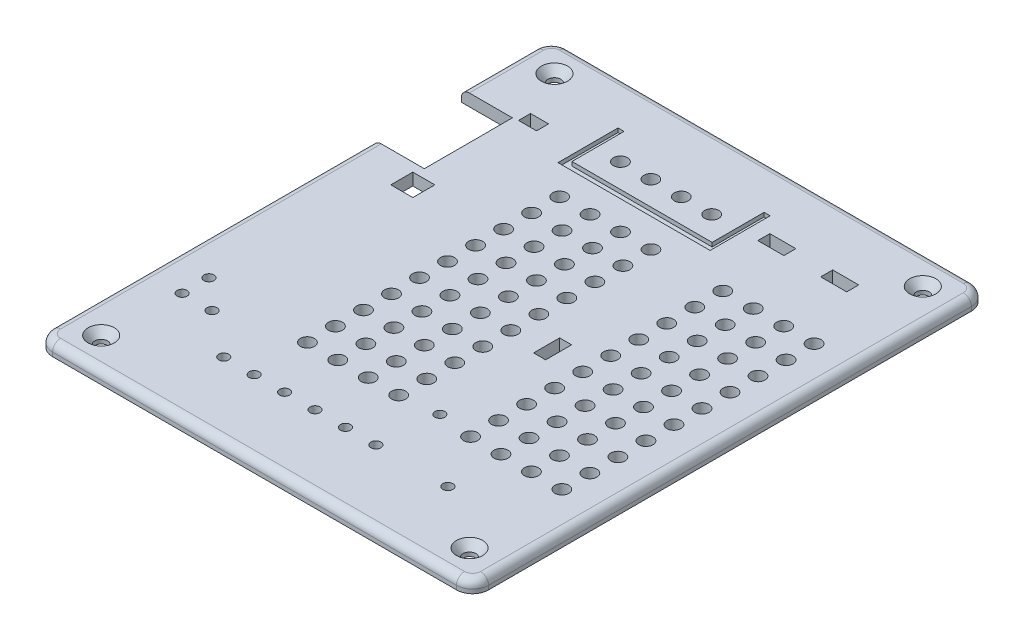
from build123d import *
from OCP.BRepFilletAPI import BRepFilletAPI_MakeChamfer

# Parameters (mm, degrees)
SKICA1_W                 = 108.89
SKICA1_H                 = 128.6
P_IDAT_VYSUNUT_M1_DEPTH  = 3
ZAOBLIT1_R               = 4
ZAOBLIT2_R               = 2
SKICA2_R                 = 1.6
ODEBRAT_VYSUNUT_M1_DEPTH = 3
LINPOLE1_COUNT           = 2
LINPOLE1_PITCH           = 113.2
LINPOLE1_COUNT_DIR2      = 2
LINPOLE1_PITCH_DIR2      = 92
ZKOSEN_1_SIZE            = 2
ZKOSEN_1_SIZE2           = 1.678199262
SKICA3_R                 = 1.75
ODEBRAT_VYSUNUT_M3_DEPTH = 4
LINPOLE3_COUNT           = 10
LINPOLE3_PITCH           = 7
LINPOLE3_COUNT_DIR2      = 4
LINPOLE3_PITCH_DIR2      = 7.6
SKICA3_3_R               = 1.75
ODEBRAT_VYSUNUT_M4_DEPTH = 4
LINPOLE4_COUNT           = 10
LINPOLE4_PITCH           = 7
LINPOLE4_COUNT_DIR2      = 4
LINPOLE4_PITCH_DIR2      = 7.6
SKICA3_4_R               = 1.75
ODEBRAT_VYSUNUT_M5_DEPTH = 10
LINPOLE5_COUNT           = 4
LINPOLE5_PITCH           = 7.6
SKICA4_R                 = 1.25
SKICA4_W                 = 6.5
SKICA4_H                 = 3
SKICA4_W_2               = 3
SKICA4_H_2               = 6.5
ODEBRAT_VYSUNUT_M6_DEPTH = 10
SKICA5_R                 = 1.25
ODEBRAT_VYSUNUT_M7_DEPTH = 10
LINPOLE6_COUNT           = 6
LINPOLE6_PITCH           = 7.6
SKICA6_W                 = 5.5
SKICA6_H                 = 5.5
SKICA6_W_2               = 12.745
SKICA6_H_2               = 22
SKICA6_W_3               = 4.5
SKICA6_H_3               = 3
ODEBRAT_VYSUNUT_M8_DEPTH = 10
ODEBRAT_VYSUNUT_M9_DEPTH = 1


with BuildPart() as part:
    # Skica1 → Přidat vysunutím1 (new body)
    with BuildSketch(Plane(origin=(0, 0, 0), x_dir=(1, 0, 0), z_dir=(0, 1, 0))):
        Rectangle(SKICA1_W, SKICA1_H)
    extrude(amount=P_IDAT_VYSUNUT_M1_DEPTH)

    # Zaoblit1
    zaoblit1_edges = [part.edges().sort_by_distance(p)[0] for p in [
        (54.445, 1.5, -64.3),
        (54.445, 1.5, 64.3),
        (-54.445, 1.5, -64.3),
        (-54.445, 1.5, 64.3),
    ]]
    fillet(zaoblit1_edges, radius=ZAOBLIT1_R)

    # Zaoblit2
    zaoblit2_edges = [part.edges().sort_by_distance(p)[0] for p in [
        (53.273427125, 3, 63.128427125),
        (0, 3, 64.3),
        (-53.273427125, 3, 63.128427125),
        (-54.445, 3, 0),
        (-53.273427125, 3, -63.128427125),
        (0, 3, -64.3),
        (53.273427125, 3, -63.128427125),
        (54.445, 3, 0),
    ]]
    fillet(zaoblit2_edges, radius=ZAOBLIT2_R)

    # Skica2 → Odebrat vysunutím1 (cut)
    with BuildSketch(Plane.XZ):
        with Locations((-46, 56.6)):
            Circle(SKICA2_R)
    odebrat_vysunut_m1 = extrude(amount=-ODEBRAT_VYSUNUT_M1_DEPTH, mode=Mode.SUBTRACT)

    # LinPole1: Odebrat vysunut_m1 2 × 2
    with Locations(*[(j * LINPOLE1_PITCH_DIR2, 0, -i * LINPOLE1_PITCH) for i in range(LINPOLE1_COUNT) for j in range(LINPOLE1_COUNT_DIR2) if (i, j) != (0, 0)]):
        add(odebrat_vysunut_m1, mode=Mode.SUBTRACT)

    # Zkosení1: one chamfer whose edges measure the first distance from different faces: ONE call of the kernel's chamfer builder (chamfer() names one face for all edges)
    zkosen_1_edges_1 = [part.edges().sort_by_distance(p)[0] for p in [
        (44.4, 3, 56.6),
    ]]
    zkosen_1_side_1 = [part.faces().sort_by_distance(p)[0] for p in [
        (44.4, 1.5, 56.6),
    ]]
    zkosen_1_edges_2 = [part.edges().sort_by_distance(p)[0] for p in [
        (44.4, 3, -56.6),
    ]]
    zkosen_1_side_2 = [part.faces().sort_by_distance(p)[0] for p in [
        (44.4, 1.5, -56.6),
    ]]
    zkosen_1_edges_3 = [part.edges().sort_by_distance(p)[0] for p in [
        (-47.6, 3, -56.6),
    ]]
    zkosen_1_side_3 = [part.faces().sort_by_distance(p)[0] for p in [
        (-47.6, 1.5, -56.6),
    ]]
    zkosen_1_edges_4 = [part.edges().sort_by_distance(p)[0] for p in [
        (-47.6, 3, 56.6),
    ]]
    zkosen_1_side_4 = [part.faces().sort_by_distance(p)[0] for p in [
        (-47.6, 1.5, 56.6),
    ]]
    zkosen_1 = BRepFilletAPI_MakeChamfer(part.part.solid().wrapped)
    for e in zkosen_1_edges_1:
        zkosen_1.Add(ZKOSEN_1_SIZE, ZKOSEN_1_SIZE2, e.wrapped, zkosen_1_side_1[0].wrapped)  # the first distance lies on this face
    for e in zkosen_1_edges_2:
        zkosen_1.Add(ZKOSEN_1_SIZE, ZKOSEN_1_SIZE2, e.wrapped, zkosen_1_side_2[0].wrapped)  # the first distance lies on this face
    for e in zkosen_1_edges_3:
        zkosen_1.Add(ZKOSEN_1_SIZE, ZKOSEN_1_SIZE2, e.wrapped, zkosen_1_side_3[0].wrapped)  # the first distance lies on this face
    for e in zkosen_1_edges_4:
        zkosen_1.Add(ZKOSEN_1_SIZE, ZKOSEN_1_SIZE2, e.wrapped, zkosen_1_side_4[0].wrapped)  # the first distance lies on this face
    add(Compound.cast(zkosen_1.Shape()), mode=Mode.REPLACE)

    # Skica3 → Odebrat vysunutím3 (cut)
    with BuildSketch(Plane(origin=(0, 3, 0), x_dir=(1, 0, 0), z_dir=(0, 1, 0))):
        with Locations((44.83, -32.38)):
            Circle(SKICA3_R)
    odebrat_vysunut_m3 = extrude(amount=-ODEBRAT_VYSUNUT_M3_DEPTH, mode=Mode.SUBTRACT)

    # LinPole3: Odebrat vysunut_m3 10 × 4
    with Locations(*[(-j * LINPOLE3_PITCH_DIR2, 0, -i * LINPOLE3_PITCH) for i in range(LINPOLE3_COUNT) for j in range(LINPOLE3_COUNT_DIR2) if (i, j) != (0, 0)]):
        add(odebrat_vysunut_m3, mode=Mode.SUBTRACT)

    # Skica3<3> → Odebrat vysunutím4 (cut)
    with BuildSketch(Plane(origin=(0, 3, 0), x_dir=(1, 0, 0), z_dir=(0, 1, 0))):
        with Locations((4.08, -32.38)):
            Circle(SKICA3_3_R)
    odebrat_vysunut_m4 = extrude(amount=-ODEBRAT_VYSUNUT_M4_DEPTH, mode=Mode.SUBTRACT)

    # LinPole4: Odebrat vysunut_m4 10 × 4
    with Locations(*[(-j * LINPOLE4_PITCH_DIR2, 0, -i * LINPOLE4_PITCH) for i in range(LINPOLE4_COUNT) for j in range(LINPOLE4_COUNT_DIR2) if (i, j) != (0, 0)]):
        add(odebrat_vysunut_m4, mode=Mode.SUBTRACT)

    # Skica3<4> → Odebrat vysunutím5 (cut)
    with BuildSketch(Plane(origin=(0, 3, 0), x_dir=(1, 0, 0), z_dir=(0, 1, 0))):
        with Locations((44.83, -32.38)):
            Circle(SKICA3_4_R)
        with Locations((4.08, -32.38)):
            Circle(SKICA3_4_R)
        with Locations((4.08, 45.8)):
            Circle(SKICA3_4_R)
    odebrat_vysunut_m5 = extrude(amount=-ODEBRAT_VYSUNUT_M5_DEPTH, mode=Mode.SUBTRACT)

    # LinPole5: Odebrat vysunutím5 ×4
    with Locations(*[(-i * LINPOLE5_PITCH, 0, 0) for i in range(1, LINPOLE5_COUNT)]):
        add(odebrat_vysunut_m5, mode=Mode.SUBTRACT)

    # Skica4 → Odebrat vysunutím6 (cut)
    with BuildSketch(Plane(origin=(0, 3, 0), x_dir=(1, 0, 0), z_dir=(0, 1, 0))):
        with Locations((13.38, -31.4)):
            Circle(SKICA4_R)
        with Locations((30, -46)):
            Circle(SKICA4_R)
        with Locations((-45, -37.4)):
            Circle(SKICA4_R)
        with Locations((-45, -30.7)):
            Circle(SKICA4_R)
        with Locations((-37.52, -37.4)):
            Circle(SKICA4_R)
        with Locations((18.75, 47.4)):
            Rectangle(SKICA4_W, SKICA4_H)
        with Locations((34.45, 47.4)):
            Rectangle(SKICA4_W, SKICA4_H)
        with Locations((13.3, -3.15)):
            Rectangle(SKICA4_W_2, SKICA4_H_2)
    extrude(amount=-ODEBRAT_VYSUNUT_M6_DEPTH, mode=Mode.SUBTRACT)

    # Skica5 → Odebrat vysunutím7 (cut)
    with BuildSketch(Plane(origin=(0, 3, 0), x_dir=(1, 0, 0), z_dir=(0, 1, 0))):
        with Locations((-26, -46)):
            Circle(SKICA5_R)
    odebrat_vysunut_m7 = extrude(amount=-ODEBRAT_VYSUNUT_M7_DEPTH, mode=Mode.SUBTRACT)

    # LinPole6: Odebrat vysunutím7 ×6
    with Locations(*[(i * LINPOLE6_PITCH, 0, 0) for i in range(1, LINPOLE6_COUNT)]):
        add(odebrat_vysunut_m7, mode=Mode.SUBTRACT)

    # Skica6 → Odebrat vysunutím8 (cut)
    with BuildSketch(Plane(origin=(0, 3, 0), x_dir=(1, 0, 0), z_dir=(0, 1, 0))):
        with Locations((-39.64, 14.87)):
            Rectangle(SKICA6_W, SKICA6_H)
        with Locations((-48.0725, 30.8)):
            Rectangle(SKICA6_W_2, SKICA6_H_2)
        with Locations((-38.12, 43.5)):
            Rectangle(SKICA6_W_3, SKICA6_H_3)
    extrude(amount=-ODEBRAT_VYSUNUT_M8_DEPTH, mode=Mode.SUBTRACT)

    # Skica7 → Odebrat vysunutím9 (cut)
    with BuildSketch(Plane(origin=(0, 3, 0), x_dir=(1, 0, 0), z_dir=(0, 1, 0))):
        Polygon((10.18, 39.8), (-24.82, 39.8), (-24.82, 52.8), (-26.32, 52.8), (-26.32, 37.8), (11.68, 37.8), (11.68, 52.8), (10.18, 52.8), align=None)
    extrude(amount=-ODEBRAT_VYSUNUT_M9_DEPTH, mode=Mode.SUBTRACT)


solid = part.part
